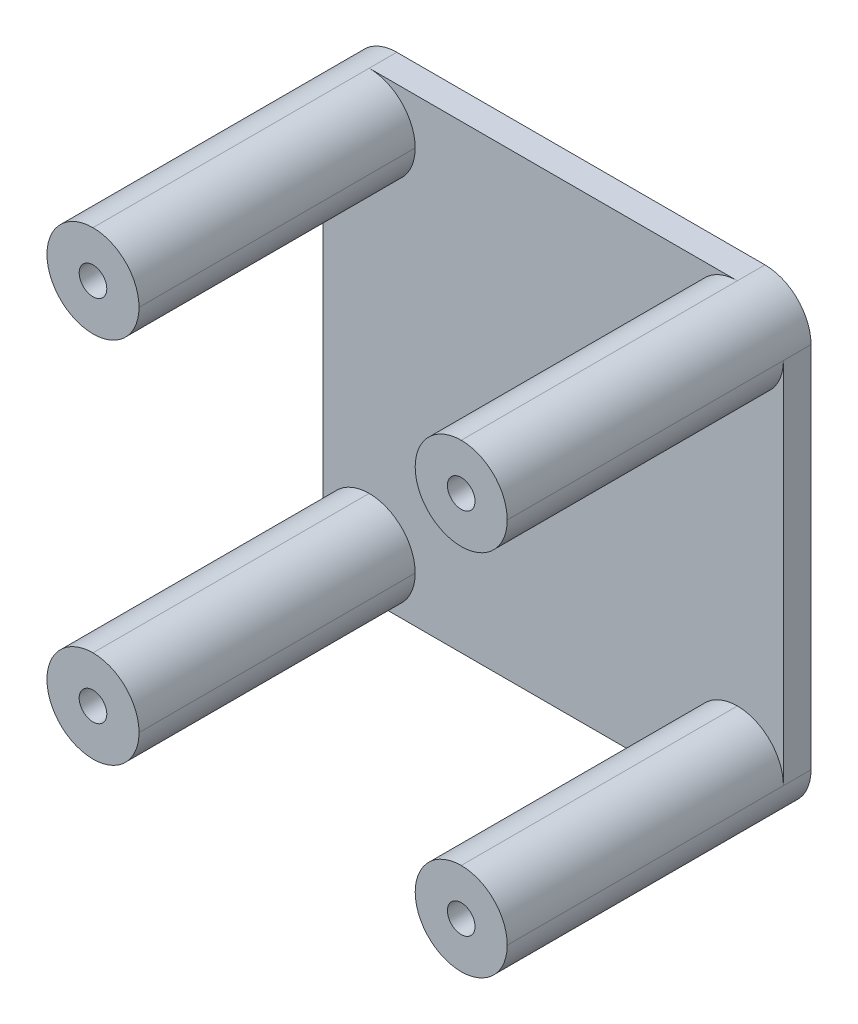
from build123d import *

# Parameters (mm, degrees)
SKETCH2_W           = 50
SKETCH2_H           = 50
SKETCH2_R           = 1.5
SKETCH2_R_2         = 1.25
BOSS_EXTRUDE1_DEPTH = 3
SKETCH3_W           = 10
SKETCH3_H           = 10
SKETCH3_R           = 1.5
BOSS_EXTRUDE2_DEPTH = 30
FILLET2_R           = 5
FILLET3_R           = 5


with BuildPart() as part:
    # Sketch2 → Boss-Extrude1 (new body)
    with BuildSketch(Plane.XY):
        with Locations((-41.57818593, 67.684487612)):
            Rectangle(SKETCH2_W, SKETCH2_H)
        with Locations((-61.57818593, 87.684487612)):
            Circle(SKETCH2_R, mode=Mode.SUBTRACT)
        with Locations((-21.57818593, 87.684487612)):
            Circle(SKETCH2_R, mode=Mode.SUBTRACT)
        with Locations((-61.57818593, 47.684487612)):
            Circle(SKETCH2_R, mode=Mode.SUBTRACT)
        with Locations((-21.57818593, 47.684487612)):
            Circle(SKETCH2_R, mode=Mode.SUBTRACT)
        with Locations((-41.57818593, 67.684487612)):
            Circle(SKETCH2_R_2, mode=Mode.SUBTRACT)
    extrude(amount=BOSS_EXTRUDE1_DEPTH)

    # Sketch3 → Boss-Extrude2 (add)
    # profile 1 of 4: a face of its own
    with BuildSketch(Plane.XY.offset(3)):
        with Locations((-61.57818593, 87.684487612)):
            Rectangle(SKETCH3_W, SKETCH3_H)
        with Locations((-61.57818593, 87.684487612)):
            Circle(SKETCH3_R, mode=Mode.SUBTRACT)
    # profile 2 of 4: a face of its own
    with BuildSketch(Plane.XY.offset(3)):
        with Locations((-21.57818593, 87.684487612)):
            Rectangle(SKETCH3_W, SKETCH3_H)
        with Locations((-21.57818593, 87.684487612)):
            Circle(SKETCH3_R, mode=Mode.SUBTRACT)
    # profile 3 of 4: a face of its own
    with BuildSketch(Plane.XY.offset(3)):
        with Locations((-21.57818593, 47.684487612)):
            Rectangle(SKETCH3_W, SKETCH3_H)
        with Locations((-21.57818593, 47.684487612)):
            Circle(SKETCH3_R, mode=Mode.SUBTRACT)
    # profile 4 of 4: a face of its own
    with BuildSketch(Plane.XY.offset(3)):
        with Locations((-61.57818593, 47.684487612)):
            Rectangle(SKETCH3_W, SKETCH3_H)
        with Locations((-61.57818593, 47.684487612)):
            Circle(SKETCH3_R, mode=Mode.SUBTRACT)
    extrude(amount=BOSS_EXTRUDE2_DEPTH)

    # Fillet2
    fillet2_edges = [part.edges().sort_by_distance(p)[0] for p in [
        (-16.57818593, 42.684487612, 16.5),
        (-66.57818593, 42.684487612, 16.5),
        (-66.57818593, 92.684487612, 16.5),
        (-16.57818593, 92.684487612, 16.5),
    ]]
    fillet(fillet2_edges, radius=FILLET2_R)

    # Fillet3
    fillet3_edges = [part.edges().sort_by_distance(p)[0] for p in [
        (-16.57818593, 82.684487612, 18),
        (-26.57818593, 82.684487612, 18),
        (-26.57818593, 92.684487612, 18),
        (-16.57818593, 52.684487612, 18),
        (-26.57818593, 52.684487612, 18),
        (-26.57818593, 42.684487612, 18),
        (-56.57818593, 42.684487612, 18),
        (-56.57818593, 52.684487612, 18),
        (-66.57818593, 52.684487612, 18),
        (-66.57818593, 82.684487612, 18),
        (-56.57818593, 82.684487612, 18),
        (-56.57818593, 92.684487612, 18),
    ]]
    fillet(fillet3_edges, radius=FILLET3_R - 0.0001)  # a hair under: the kernel refuses the full size


solid = part.part
